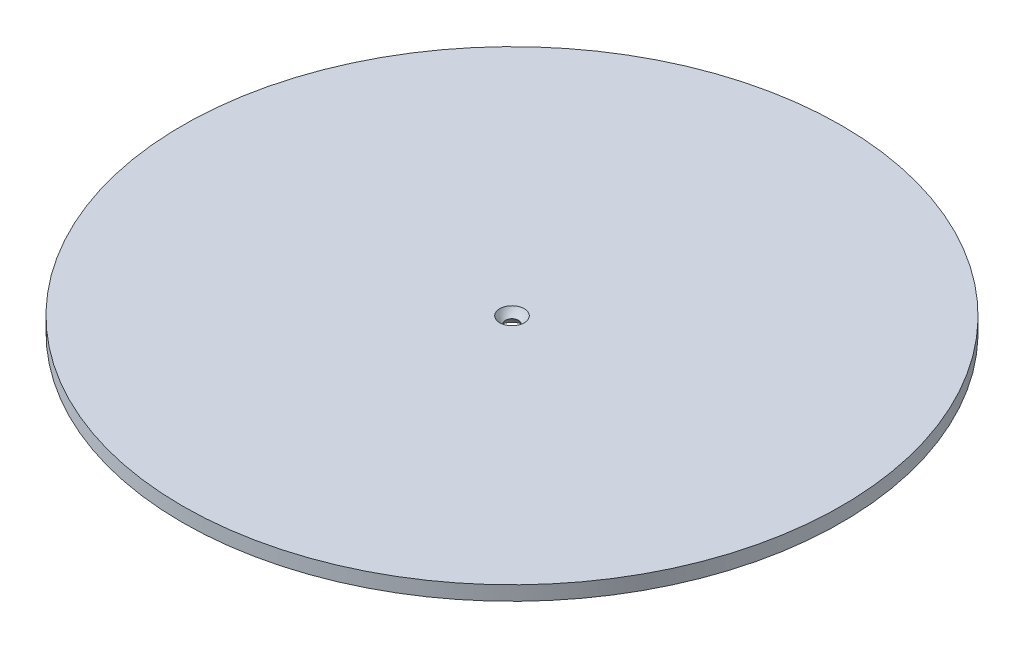
from build123d import *

# Parameters (mm, degrees)
SKETCH1_R           = 1150.00024
BOSS_EXTRUDE1_DEPTH = 50


with BuildPart() as part:
    # Sketch1 → Boss-Extrude1 (new body)
    with BuildSketch(Plane(origin=(0, 0, 0), x_dir=(1, 0, 0), z_dir=(0, 1, 0))):
        Circle(SKETCH1_R)
    extrude(amount=BOSS_EXTRUDE1_DEPTH)

    # Sketch2 → Cut-Revolve1 (revolve, cut)
    with BuildSketch(Plane.XY):
        with BuildLine():
            Line((0, 0), (0, 50))
            Line((0, 50), (42.704112888, 50))
            ThreePointArc((42.704112888, 50), (33.952555247, 36.459958096), (22.281337432, 25.337675478))
            ThreePointArc((22.281337432, 25.337675478), (34.122583246, 13.982542532), (42.704112888, 0))
            Line((42.704112888, 0), (0, 0))
        make_face()
    revolve(axis=Axis((0, 0, 0), (0, 1, 0)), mode=Mode.SUBTRACT)


solid = part.part
